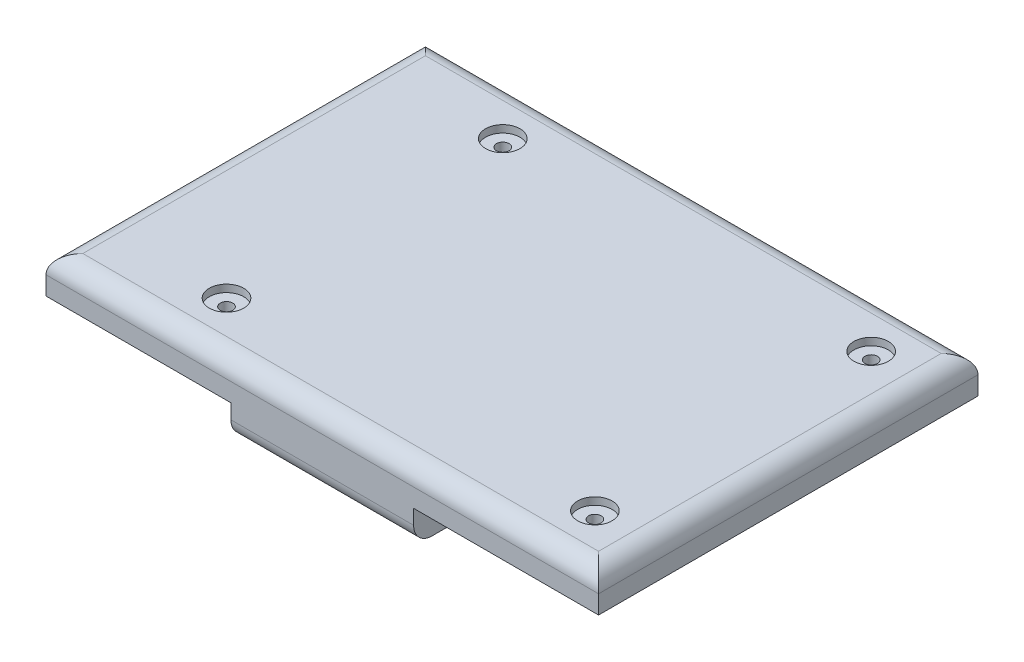
from build123d import *

# Parameters (mm, degrees)
SKETCH1_W                                    = 150
SKETCH1_H                                    = 103
BOSS_EXTRUDE1_DEPTH                          = 10
SKETCH2_W                                    = 49.6
SKETCH2_H                                    = 13.8
BOSS_EXTRUDE2_DEPTH                          = 9
SKETCH4_W                                    = 138
SKETCH4_H                                    = 63
CUT_EXTRUDE1_DEPTH                           = 7
FILLET1_R                                    = 5
CBORE_FOR_M3_HEX_HEAD_CAP_SCREW1_D           = 3.4
CBORE_FOR_M3_HEX_HEAD_CAP_SCREW1_CBORE_D     = 9.351
CBORE_FOR_M3_HEX_HEAD_CAP_SCREW1_CBORE_DEPTH = 2


with BuildPart() as part:
    # Sketch1 → Boss-Extrude1 (new body)
    with BuildSketch(Plane(origin=(0, 0, 0), x_dir=(1, 0, 0), z_dir=(0, 1, 0))):
        with Locations((75, 51.5)):
            Rectangle(SKETCH1_W, SKETCH1_H)
    extrude(amount=BOSS_EXTRUDE1_DEPTH)

    # Sketch2 → Boss-Extrude2 (add)
    with BuildSketch(Plane.XZ):
        with Locations((75, -6.9)):
            Rectangle(SKETCH2_W, SKETCH2_H)
        with Locations((75, -96.1)):
            Rectangle(SKETCH2_W, SKETCH2_H)
    extrude(amount=BOSS_EXTRUDE2_DEPTH)

    # Sketch4 → Cut-Extrude1 (cut)
    with BuildSketch(Plane.XZ):
        with Locations((75, -51.5)):
            Rectangle(SKETCH4_W, SKETCH4_H)
    extrude(amount=-CUT_EXTRUDE1_DEPTH, mode=Mode.SUBTRACT)

    # Fillet1
    fillet1_edges = [part.edges().sort_by_distance(p)[0] for p in [
        (75, -9, -89.2),
        (75, -9, -103),
        (75, -9, -13.8),
        (75, -9, 0),
        (150, 10, -51.5),
        (75, 10, -103),
        (75, 10, 0),
        (0, 10, -51.5),
    ]]
    fillet(fillet1_edges, radius=FILLET1_R)

    # CBORE for M3 Hex Head Cap Screw1 (through all)
    with Locations(Plane(origin=(0, 10, 0), x_dir=(1, 0, 0), z_dir=(0, 1, 0))):
        with Locations((35, 89), (35, 14), (135, 14), (135, 89)):
            CounterBoreHole(CBORE_FOR_M3_HEX_HEAD_CAP_SCREW1_D / 2, CBORE_FOR_M3_HEX_HEAD_CAP_SCREW1_CBORE_D / 2, CBORE_FOR_M3_HEX_HEAD_CAP_SCREW1_CBORE_DEPTH)


solid = part.part
